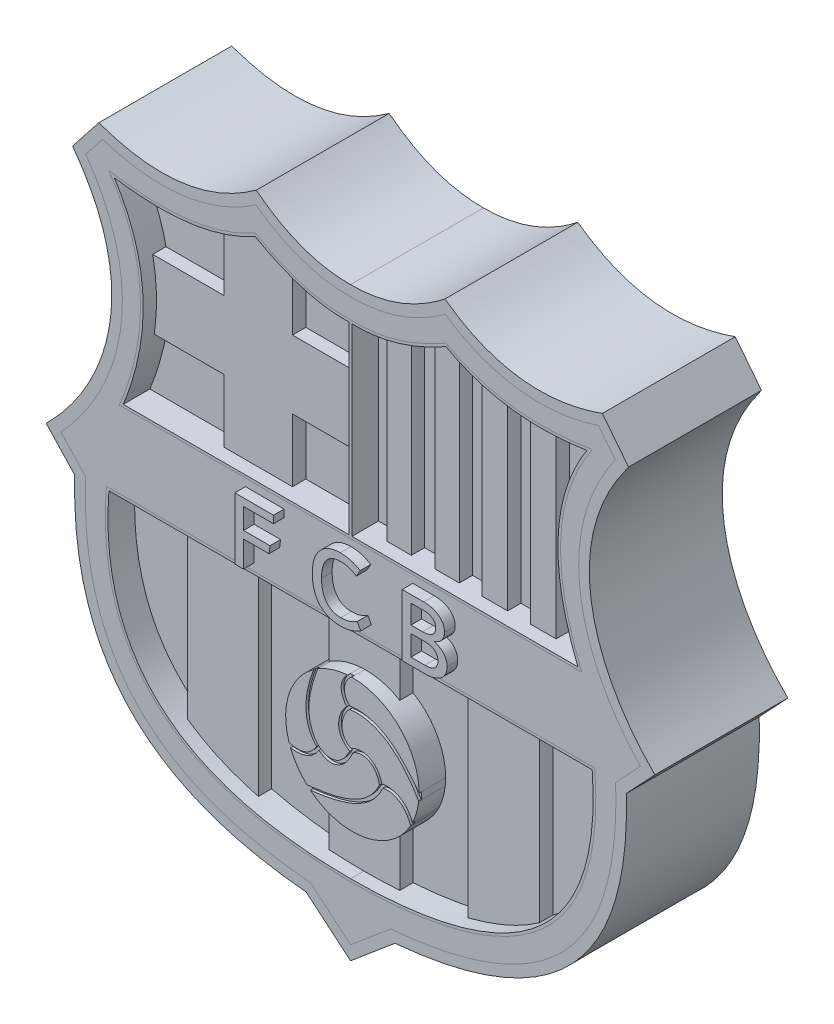
from build123d import *

# Parameters (mm, degrees)
BOSS_EXTRUDE1_DEPTH    = 50
BOSS_EXTRUDE6_DEPTH    = 200
BOSS_EXTRUDE7_DEPTH    = 20
BOSS_EXTRUDE8_DEPTH    = 25
BOSS_EXTRUDE9_DEPTH    = 25
BOSS_EXTRUDE10_DEPTH   = 25
BOSS_EXTRUDE11_DEPTH   = 50
BOSS_EXTRUDE11_2_DEPTH = 50
BOSS_EXTRUDE11_3_DEPTH = 50
BOSS_EXTRUDE11_4_DEPTH = 50
BOSS_EXTRUDE11_5_DEPTH = 50
BOSS_EXTRUDE11_6_DEPTH = 50
BOSS_EXTRUDE12_DEPTH   = 45
BOSS_EXTRUDE13_DEPTH   = 250
BOSS_EXTRUDE14_DEPTH   = 50
BOSS_EXTRUDE15_DEPTH   = 50
SCALE1_SCALE           = 0.025


with BuildPart() as part:
    # Sketch1 → Boss-Extrude1 (new body)
    with BuildSketch(Plane.XY):
        with BuildLine():
            Line((133.46356752, 1126.986385644), (102.003199872, 1087.003819543))
            add(Edge.make_bspline(
                [(102.003199872, 1087.003819543), (226.59890822, 910.602601387), (164.417183447, 726.984348134), (55.005234339, 611.019063396)],
                knots=[0, 0, 0, 0, 1, 1, 1, 1], degree=3))
            Line((55.005234339, 611.019063396), (101.459625842, 561.530346196))
            add(Edge.make_bspline(
                [(101.459625842, 561.530346196), (91.839945119, 295.037245246), (208.985417933, 138.161620848), (524.532272448, 111.554095907)],
                knots=[0, 0, 0, 0, 1, 1, 1, 1], degree=3))
            Line((524.532272448, 111.554095907), (600, 48.025782711))
            Line((600, 48.025782711), (675.467727552, 111.554095907))
            add(Edge.make_bspline(
                [(1098.540374158, 561.530346196), (1108.160054881, 295.037245246), (991.014582067, 138.161620848), (675.467727552, 111.554095907)],
                knots=[0, 0, 0, 0, 1, 1, 1, 1], degree=3))
            Line((1098.540374158, 561.530346196), (1144.994765661, 611.019063396))
            add(Edge.make_bspline(
                [(1097.996800128, 1087.003819543), (973.40109178, 910.602601387), (1035.582816553, 726.984348134), (1144.994765661, 611.019063396)],
                knots=[0, 0, 0, 0, 1, 1, 1, 1], degree=3))
            Line((1097.996800128, 1087.003819543), (1066.53643248, 1126.986385644))
            add(Edge.make_bspline(
                [(1066.53643248, 1126.986385644), (956.376381864, 1090.894186077), (858.242372746, 1109.560348258), (778.016213479, 1164.016239891)],
                knots=[0, 0, 0, 0, 1, 1, 1, 1], degree=3))
            add(Edge.make_bspline(
                [(778.016213479, 1164.016239891), (694.016596835, 1102.729663633), (600, 1103.445934964)],
                knots=[0, 0, 0, 1, 1, 1], degree=2))
            add(Edge.make_bspline(
                [(421.983786521, 1164.016239891), (505.983403165, 1102.729663633), (600, 1103.445934964)],
                knots=[0, 0, 0, 1, 1, 1], degree=2))
            add(Edge.make_bspline(
                [(133.46356752, 1126.986385644), (243.623618136, 1090.894186077), (341.757627254, 1109.560348258), (421.983786521, 1164.016239891)],
                knots=[0, 0, 0, 0, 1, 1, 1, 1], degree=3))
        make_face()
        with BuildLine():
            Line((172.441007034, 714.584022584), (1027.558992966, 714.584022584))
            add(Edge.make_bspline(
                [(1044.51545144, 1075.547155929), (979.007192098, 974.464177507), (971.599630022, 853.448573897), (1027.558992966, 714.584022584)],
                knots=[0, 0, 0, 0, 1, 1, 1, 1], degree=3))
            add(Edge.make_bspline(
                [(779.496937286, 1112.101280667), (857.550676858, 1068.974155239), (945.835947373, 1060.649513102), (1044.51545144, 1075.547155929)],
                knots=[0, 0, 0, 0, 1, 1, 1, 1], degree=3))
            add(Edge.make_bspline(
                [(779.496937286, 1112.101280667), (725.028679692, 1081.546713353), (665.061052799, 1058.223258661), (600, 1061.197954031)],
                knots=[0, 0, 0, 0, 1, 1, 1, 1], degree=3))
            add(Edge.make_bspline(
                [(420.503062714, 1112.101280667), (474.971320308, 1081.546713353), (534.938947201, 1058.223258661), (600, 1061.197954031)],
                knots=[0, 0, 0, 0, 1, 1, 1, 1], degree=3))
            add(Edge.make_bspline(
                [(420.503062714, 1112.101280667), (342.449323142, 1068.974155239), (254.164052627, 1060.649513102), (155.48454856, 1075.547155929)],
                knots=[0, 0, 0, 0, 1, 1, 1, 1], degree=3))
            add(Edge.make_bspline(
                [(155.48454856, 1075.547155929), (220.992807902, 974.464177507), (228.400369978, 853.448573897), (172.441007034, 714.584022584)],
                knots=[0, 0, 0, 0, 1, 1, 1, 1], degree=3))
        make_face(mode=Mode.SUBTRACT)
        with BuildLine():
            Line((145.430413216, 560.4872641), (1054.569586784, 560.4872641))
            add(Edge.make_bspline(
                [(1054.569586784, 560.4872641), (1076.926440053, 261.321472085), (886.665840762, 156.321066377), (600, 155.632939768)],
                knots=[0, 0, 0, 0, 1, 1, 1, 1], degree=3))
            add(Edge.make_bspline(
                [(145.430413216, 560.4872641), (123.073559947, 261.321472085), (313.334159238, 156.321066377), (600, 155.632939768)],
                knots=[0, 0, 0, 0, 1, 1, 1, 1], degree=3))
        make_face(mode=Mode.SUBTRACT)
    extrude(amount=BOSS_EXTRUDE1_DEPTH)

    # Sketch17 → Boss-Extrude6 (add)
    with BuildSketch(Plane(origin=(0, 0, 0), x_dir=(-1, 0, 0), z_dir=(0, 0, -1))):
        with BuildLine():
            Line((-1066.53643248, 1126.986385644), (-1097.996800128, 1087.003819543))
            add(Edge.make_bspline(
                [(-1097.996800128, 1087.003819543), (-973.40109178, 910.602601387), (-1035.582816553, 726.984348134), (-1144.994765661, 611.019063396)],
                knots=[0, 0, 0, 0, 1, 1, 1, 1], degree=3))
            Line((-1144.994765661, 611.019063396), (-1098.540374158, 561.530346196))
            add(Edge.make_bspline(
                [(-1098.540374158, 561.530346196), (-1108.160054881, 295.037245246), (-991.014582067, 138.161620848), (-675.467727552, 111.554095907)],
                knots=[0, 0, 0, 0, 1, 1, 1, 1], degree=3))
            Line((-675.467727552, 111.554095907), (-600, 48.025782711))
            Line((-600, 48.025782711), (-524.532272448, 111.554095907))
            add(Edge.make_bspline(
                [(-524.532272448, 111.554095907), (-208.985417933, 138.161620848), (-91.839945119, 295.037245246), (-101.459625842, 561.530346196)],
                knots=[0, 0, 0, 0, 1, 1, 1, 1], degree=3))
            Line((-101.459625842, 561.530346196), (-55.005234339, 611.019063396))
            add(Edge.make_bspline(
                [(-55.005234339, 611.019063396), (-164.417183447, 726.984348134), (-226.59890822, 910.602601387), (-102.003199872, 1087.003819543)],
                knots=[0, 0, 0, 0, 1, 1, 1, 1], degree=3))
            Line((-102.003199872, 1087.003819543), (-133.46356752, 1126.986385644))
            add(Edge.make_bspline(
                [(-133.46356752, 1126.986385644), (-243.623618136, 1090.894186077), (-341.757627254, 1109.560348258), (-421.983786521, 1164.016239891)],
                knots=[0, 0, 0, 0, 1, 1, 1, 1], degree=3))
            add(Edge.make_bspline(
                [(-421.983786521, 1164.016239891), (-505.983403168, 1102.72966363), (-600.000000008, 1103.445934964)],
                knots=[0, 0, 0, 1, 1, 1], degree=2))
            add(Edge.make_bspline(
                [(-600.000000008, 1103.445934964), (-694.016596803, 1102.729663636), (-778.016213415, 1164.016239844)],
                knots=[0, 0, 0, 1, 1, 1], degree=2))
            add(Edge.make_bspline(
                [(-778.016213415, 1164.016239844), (-858.242372746, 1109.560348258), (-956.376381864, 1090.894186077), (-1066.53643248, 1126.986385644)],
                knots=[0, 0, 0, 0, 1, 1, 1, 1], degree=3))
        make_face()
    extrude(amount=BOSS_EXTRUDE6_DEPTH)

    # Sketch18 → Boss-Extrude7 (add)
    # profile 1 of 3: a face of its own
    with BuildSketch(Plane.XY.offset(50)):
        Polygon((475.105998454, 681.423513201), (418.659569882, 681.423513201), (418.659569882, 642.351191773), (468.477427025, 642.351191773), (466.664927025, 628.394941773), (418.659569882, 628.394941773), (418.659569882, 579.379763201), (402.19171274, 579.379763201), (402.19171274, 695.379763201), (475.105998454, 695.379763201), align=None)
    # profile 2 of 3: a face of its own
    with BuildSketch(Plane.XY.offset(50)):
        with BuildLine():
            add(Edge.make_bspline(
                [(601.09171274, 577.722620344), (599.64078982, 577.736546109), (596.803148816, 577.763781409), (592.637975877, 578.152143343), (588.660733179, 578.710587918), (584.847529131, 579.477291582), (581.235418211, 580.518104432), (577.788756655, 581.764633074), (574.525723668, 583.230393223), (571.459506686, 584.951956666), (568.585197073, 586.8753144), (565.873644104, 588.964972852), (563.397625684, 591.287782315), (561.069793374, 593.754782096), (558.93837799, 596.424908978), (557.039393152, 599.310346491), (555.279005243, 602.348346165), (553.764333604, 605.597871871), (552.425076042, 609.008144549), (551.255584939, 612.569227776), (550.270743801, 616.278316318), (549.481319636, 620.145444362), (548.817097072, 624.150206808), (548.402751596, 628.310786234), (548.090518187, 632.610726673), (548.072368168, 635.532123635), (548.063141311, 637.017263201)],
                knots=[0, 0, 0, 0, 1.152401246, 2.253807549, 3.320597844, 4.342723539, 5.341203386, 6.304395466, 7.252752992, 8.179923201, 9.094762417, 9.998742316, 10.896457915, 11.789156762, 12.69199146, 13.606830677, 14.531410523, 15.479296852, 16.452204652, 17.441077364, 18.455745475, 19.499406348, 20.576069463, 21.679459379, 22.820315508, 24, 24, 24, 24], degree=3))
            add(Edge.make_bspline(
                [(548.063141311, 637.017263201), (548.076728654, 638.727024194), (548.103250193, 642.064357608), (548.493779535, 646.953288135), (549.039172089, 651.606872279), (549.849546238, 656.032934079), (550.869111642, 660.224215315), (552.151749987, 664.171069103), (553.61041163, 667.900212829), (555.360301187, 671.363736199), (557.278519605, 674.597686727), (559.328918781, 677.6222799), (561.528652818, 680.41505828), (563.853244409, 682.988488091), (566.336918935, 685.310103856), (568.960625632, 687.41134927), (571.71890666, 689.311087435), (574.644370873, 690.927542563), (577.639112249, 692.382926177), (580.726947571, 693.63182089), (583.89444379, 694.649142995), (587.108619811, 695.550741349), (590.405739726, 696.221465205), (593.779781809, 696.678643342), (597.219872938, 696.972780497), (599.537552649, 697.015445855), (600.703319882, 697.036906058)],
                knots=[0, 0, 0, 0, 1.362261834, 2.659039452, 3.906420423, 5.095084035, 6.242900915, 7.341449979, 8.400368739, 9.430912882, 10.430126428, 11.395525412, 12.340916007, 13.261249953, 14.156698004, 15.047271391, 15.93826972, 16.82220361, 17.708249395, 18.59089764, 19.47405501, 20.358497285, 21.250212245, 22.152975353, 23.070967052, 24, 24, 24, 24], degree=3))
            add(Edge.make_bspline(
                [(600.703319882, 697.036906058), (602.474163744, 697.013133424), (605.954760536, 696.966408269), (611.056417772, 696.419323172), (615.950495213, 695.611865507), (620.642090118, 694.421280245), (625.194553586, 692.959048044), (629.602464881, 691.109092942), (633.954153774, 689.041666258), (636.724071926, 687.384530705), (638.118498454, 686.550298915)],
                knots=[0, 0, 0, 0, 1.078692588, 2.120172219, 3.123210728, 4.099087256, 5.067122433, 6.034099663, 7.010330475, 8, 8, 8, 8], degree=3))
            Line((638.118498454, 686.550298915), (630.99796274, 674.121727487))
            add(Edge.make_bspline(
                [(630.99796274, 674.121727487), (629.842648414, 674.838043645), (627.558352419, 676.25434923), (623.984019696, 678.063088733), (620.364379066, 679.622189893), (616.68203127, 680.903327804), (612.927074029, 681.85668375), (609.120596735, 682.548928963), (605.246400344, 683.021707986), (602.63805537, 683.060915165), (601.324748454, 683.080656058)],
                knots=[0, 0, 0, 0, 1.037467206, 2.051287802, 3.055013741, 4.044908042, 5.024660619, 6.009563252, 6.997811112, 8, 8, 8, 8], degree=3))
            add(Edge.make_bspline(
                [(601.324748454, 683.080656058), (599.829713602, 683.050033861), (596.93156437, 682.990672238), (592.738652643, 682.414628631), (588.858544831, 681.459310632), (585.269732594, 680.138929242), (581.979284558, 678.417133839), (578.985902519, 676.317867907), (576.312767096, 673.817501905), (573.951987783, 670.958941055), (571.924451582, 667.751502741), (570.13416109, 664.293975719), (568.588519342, 660.577943243), (567.390534831, 656.562769786), (566.436762604, 652.287508454), (565.738543241, 647.738528147), (565.320668417, 642.92012358), (565.277904328, 639.616031885), (565.255998454, 637.923513201)],
                knots=[0, 0, 0, 0, 1.090208122, 2.11338607, 3.080077519, 4.00054902, 4.896176672, 5.781877576, 6.65955173, 7.558471289, 8.47894279, 9.422387076, 10.396433003, 11.410268442, 12.475013277, 13.589961148, 14.765459267, 16, 16, 16, 16], degree=3))
            add(Edge.make_bspline(
                [(565.255998454, 637.923513201), (565.289176182, 636.170706256), (565.353828854, 632.755051838), (565.758489543, 627.770708952), (566.478876945, 623.080707545), (567.493520572, 618.676270994), (568.766446164, 614.549723451), (570.383890681, 610.735965405), (572.257012772, 607.199141514), (574.41429067, 603.961804269), (576.890707228, 601.076140689), (579.60842609, 598.537570208), (582.632720293, 596.422550156), (585.915044132, 594.673023427), (589.485505558, 593.326760648), (593.319779576, 592.385266812), (597.411720546, 591.759521327), (600.234805196, 591.706268359), (601.687248454, 591.678870344)],
                knots=[0, 0, 0, 0, 1.259694321, 2.454737236, 3.590776693, 4.66657999, 5.700420284, 6.689995947, 7.639006296, 8.573143387, 9.479372, 10.366030153, 11.238516259, 12.123676147, 13.032596606, 13.97282991, 14.957045255, 16, 16, 16, 16], degree=3))
            add(Edge.make_bspline(
                [(601.687248454, 591.678870344), (603.164293937, 591.709285485), (606.056049399, 591.768832161), (610.271085949, 592.215865892), (614.267474563, 592.928673685), (618.064561602, 593.983307081), (621.740119411, 595.337973356), (625.397041019, 596.881507329), (629.041548716, 598.707232972), (631.419420931, 600.089764479), (632.62921274, 600.793156058)],
                knots=[0, 0, 0, 0, 1.084007551, 2.122266913, 3.107669922, 4.060605003, 5.010523825, 5.981318343, 6.972953837, 8, 8, 8, 8], degree=3))
            Line((632.62921274, 600.793156058), (639.205998454, 588.90833463))
            add(Edge.make_bspline(
                [(639.205998454, 588.90833463), (637.662621064, 588.026003784), (634.627508856, 586.290865547), (629.984294545, 584.064556992), (625.430578209, 582.091924023), (620.872492353, 580.495874552), (616.225247492, 579.216542934), (611.380426549, 578.354669664), (606.307900099, 577.827550779), (602.853740771, 577.758065844), (601.09171274, 577.722620344)],
                knots=[0, 0, 0, 0, 1.059879771, 2.084295166, 3.069031927, 4.018092589, 4.962058864, 5.940371365, 6.949346847, 8, 8, 8, 8], degree=3))
        make_face()
    # profile 3 of 3: a face of its own
    with BuildSketch(Plane.XY.offset(50)):
        with BuildLine():
            add(Edge.make_bspline(
                [(776.895284168, 640.56458463), (777.918533608, 640.304597264), (779.926450071, 639.79442556), (782.783003775, 638.774191737), (785.446257187, 637.639697929), (787.893579979, 636.346224248), (790.122401017, 634.879347525), (792.19383037, 633.317885528), (794.00255705, 631.53913759), (795.608646006, 629.639584705), (797.040196134, 627.653631762), (798.243852035, 625.56459402), (799.328567112, 623.444706681), (800.178837284, 621.238941788), (800.824955027, 618.974782945), (801.293310134, 616.654856432), (801.584473535, 614.273427393), (801.627285645, 612.661527052), (801.648855597, 611.849406058)],
                knots=[0, 0, 0, 0, 1.229068441, 2.411793899, 3.528508263, 4.598830236, 5.630498207, 6.633860536, 7.614917479, 8.577726652, 9.528973143, 10.461713734, 11.383336897, 12.299957327, 13.2099387, 14.122747572, 15.054187117, 16, 16, 16, 16], degree=3))
            add(Edge.make_bspline(
                [(801.648855597, 611.849406058), (801.586493769, 610.334981127), (801.463890706, 607.357628769), (800.573661413, 603.012270057), (799.044708957, 598.927359451), (796.94983634, 595.095765085), (794.219526969, 591.605359121), (790.92650798, 588.451661133), (786.980680622, 585.764076205), (782.488525391, 583.459576701), (777.42880144, 581.617844176), (771.83839686, 580.327943483), (765.742532915, 579.505452392), (761.509117662, 579.422681195), (759.314034168, 579.379763201)],
                knots=[0, 0, 0, 0, 0.908229122, 1.785574223, 2.647318915, 3.516343686, 4.39460501, 5.295528646, 6.240601218, 7.247931, 8.31756617, 9.461667013, 10.683839759, 12, 12, 12, 12], degree=3))
            Line((759.314034168, 579.379763201), (717.134569882, 579.379763201))
            Line((717.134569882, 579.379763201), (717.134569882, 695.379763201))
            Line((717.134569882, 695.379763201), (757.630998454, 695.379763201))
            add(Edge.make_bspline(
                [(757.630998454, 695.379763201), (759.592630829, 695.340379894), (763.383611786, 695.264269116), (768.858979732, 694.52939441), (773.913251922, 693.322341778), (778.533377988, 691.640697423), (782.691777975, 689.560934127), (786.327325724, 687.072096231), (789.493529248, 684.266326544), (792.08020711, 681.059091741), (794.162749881, 677.572190633), (795.61135578, 673.787449881), (796.531341748, 669.755338476), (796.628065251, 666.971760245), (796.677427025, 665.551191773)],
                knots=[0, 0, 0, 0, 1.281114256, 2.475835845, 3.601497442, 4.6701157, 5.681428971, 6.630867444, 7.541286769, 8.435227113, 9.312433322, 10.183728554, 11.073085884, 12, 12, 12, 12], degree=3))
            add(Edge.make_bspline(
                [(796.677427025, 665.551191773), (796.63006177, 664.181792687), (796.536924302, 661.489051743), (795.578868078, 657.587726458), (794.099964996, 653.896979036), (792.336286173, 651.060606446), (790.663361655, 648.919593765), (789.20248847, 647.413149235), (787.564925652, 646.020616935), (785.769714029, 644.712337159), (783.789094198, 643.536867905), (781.669518607, 642.40470422), (779.345745245, 641.430991799), (777.726774324, 640.858573806), (776.895284168, 640.56458463)],
                knots=[0, 0, 0, 0, 1.43366631, 2.819113884, 4.187392771, 5.589272928, 6.304604261, 7.03439392, 7.785485683, 8.556813947, 9.360959316, 10.199081699, 11.075063166, 12, 12, 12, 12], degree=3))
        make_face()
        with BuildLine():
            Line((733.602427025, 681.423513201), (733.602427025, 645.665477487))
            Line((733.602427025, 645.665477487), (755.455998454, 645.665477487))
            add(Edge.make_bspline(
                [(755.455998454, 645.665477487), (757.211258951, 645.717916701), (760.570504189, 645.818275697), (765.353873214, 646.634655882), (769.611258669, 648.044633771), (772.778903264, 649.659019205), (774.972194352, 651.266010104), (776.389113624, 652.642784266), (777.550589077, 654.226040623), (778.550266346, 655.933950004), (779.305515744, 657.819230059), (779.806490827, 659.869166323), (780.165252243, 662.07771606), (780.194463866, 663.616279004), (780.209569882, 664.411906058)],
                knots=[0, 0, 0, 0, 1.79175693, 3.429092685, 4.934105334, 6.357253839, 7.037662009, 7.704521192, 8.365530619, 9.036743662, 9.72085205, 10.430540755, 11.188395743, 12, 12, 12, 12], degree=3))
            add(Edge.make_bspline(
                [(780.209569882, 664.411906058), (780.17972809, 665.208007933), (780.120812727, 666.779717538), (779.653349451, 669.072811959), (778.833569193, 671.223512528), (777.717373377, 673.221281135), (776.301203191, 675.068218033), (774.55690728, 676.696458197), (772.501751533, 678.10730922), (770.159107633, 679.294930359), (767.534001378, 680.248978182), (764.64342289, 680.944619771), (761.492602073, 681.361631009), (759.306725156, 681.402400395), (758.174748454, 681.423513201)],
                knots=[0, 0, 0, 0, 0.914983896, 1.806413252, 2.676426615, 3.551688379, 4.429085617, 5.341806165, 6.283316826, 7.286417286, 8.353924127, 9.487653094, 10.698957777, 12, 12, 12, 12], degree=3))
            Line((758.174748454, 681.423513201), (733.602427025, 681.423513201))
        make_face(mode=Mode.SUBTRACT)
        with BuildLine():
            add(Edge.make_bspline(
                [(759.75421274, 593.336013201), (760.807793253, 593.347380997), (762.840748815, 593.369315936), (765.772364228, 593.635790313), (768.479566101, 594.047684151), (770.965162315, 594.595229331), (773.215545539, 595.357718525), (775.245039724, 596.265372428), (777.078969765, 597.306580288), (778.639398089, 598.58441304), (780.011628045, 599.945887808), (781.189994799, 601.421505581), (782.207304119, 602.976206328), (783.042318061, 604.632600409), (783.656203925, 606.39601109), (784.136078735, 608.228385359), (784.38526558, 610.168299145), (784.432070564, 611.48631656), (784.455998454, 612.160120344)],
                knots=[0, 0, 0, 0, 1.435199343, 2.769315158, 4.00678371, 5.165046219, 6.232393296, 7.237819299, 8.191860384, 9.095498011, 9.976977071, 10.821843515, 11.66342955, 12.50493341, 13.341905271, 14.203307508, 15.08148543, 16, 16, 16, 16], degree=3))
            add(Edge.make_bspline(
                [(784.455998454, 612.160120344), (784.434617669, 612.894571414), (784.39294691, 614.326003091), (784.112193381, 616.411506925), (783.611817525, 618.369916065), (782.935847333, 620.217894403), (782.087757936, 621.966784294), (781.007397717, 623.586336146), (779.737880693, 625.088135875), (778.275684646, 626.464281658), (776.647863621, 627.716637406), (774.807478844, 628.783532092), (772.781617856, 629.682102341), (770.574758205, 630.439037231), (768.178304836, 630.997085205), (765.600103795, 631.408030556), (762.832416368, 631.674909411), (760.920030661, 631.697564036), (759.93546274, 631.709227487)],
                knots=[0, 0, 0, 0, 0.991708695, 1.932822074, 2.834503666, 3.715692415, 4.586102876, 5.452368317, 6.337248569, 7.235836904, 8.15888109, 9.104314168, 10.100668534, 11.147348607, 12.249770514, 13.418513648, 14.670953961, 16, 16, 16, 16], degree=3))
            Line((759.93546274, 631.709227487), (733.602427025, 631.709227487))
            Line((733.602427025, 631.709227487), (733.602427025, 593.336013201))
            Line((733.602427025, 593.336013201), (759.75421274, 593.336013201))
        make_face(mode=Mode.SUBTRACT)
    extrude(amount=BOSS_EXTRUDE7_DEPTH)

    # Sketch20 → Boss-Extrude8 (add)
    with BuildSketch(Plane.XY):
        with BuildLine():
            Line((598.066093468, 961.645965498), (598.066093468, 833.080043233))
            Line((598.066093468, 833.080043233), (465.797978764, 833.080043233))
            Line((465.797978764, 833.080043233), (465.797978764, 714.584022584))
            Line((465.797978764, 714.584022584), (336.953418896, 714.584022584))
            Line((336.953418896, 714.584022584), (336.953418896, 833.080043233))
            Line((336.953418896, 833.080043233), (205.603276252, 833.080043233))
            add(Edge.make_bspline(
                [(202.801295823, 961.645965498), (211.267976093, 921.147951999), (212.278954581, 878.262184077), (205.603276252, 833.080043233)],
                knots=[0.351533435, 0.351533435, 0.351533435, 0.351533435, 0.704182388, 0.704182388, 0.704182388, 0.704182388], degree=3))
            Line((202.801295823, 961.645965498), (336.953418896, 961.645965498))
            Line((336.953418896, 961.645965498), (336.953418896, 1079.633198014))
            add(Edge.make_bspline(
                [(420.503062714, 1112.101280667), (393.848495135, 1097.373800785), (366.00077363, 1086.704825911), (336.953418896, 1079.633198014)],
                knots=[0, 0, 0, 0, 0.341489949, 0.341489949, 0.341489949, 0.341489949], degree=3))
            add(Edge.make_bspline(
                [(465.797978764, 1089.317224126), (450.304418802, 1096.135304794), (435.203453337, 1103.854935095), (420.503062714, 1112.101280667)],
                knots=[0.730110871, 0.730110871, 0.730110871, 0.730110871, 1, 1, 1, 1], degree=3))
            Line((465.797978764, 1089.317224126), (465.797978764, 961.645965498))
            Line((465.797978764, 961.645965498), (598.066093468, 961.645965498))
        make_face()
    extrude(amount=BOSS_EXTRUDE8_DEPTH)

    # Sketch21 → Boss-Extrude9 (add)
    with BuildSketch(Plane.XY):
        with BuildLine():
            Line((643.219410565, 1062.977132612), (643.219410565, 714.584022584))
            Line((643.219410565, 714.584022584), (689.367418135, 714.584022584))
            Line((689.367418135, 714.584022584), (689.367418135, 1072.759310695))
            add(Edge.make_bspline(
                [(689.367418135, 1072.759310695), (674.314041424, 1068.318934527), (658.929248289, 1064.958447466), (643.219410565, 1062.977132612)],
                knots=[0.524187621, 0.524187621, 0.524187621, 0.524187621, 0.774567634, 0.774567634, 0.774567634, 0.774567634], degree=3))
        make_face()
        with BuildLine():
            Line((733.91816673, 1089.192431639), (733.91816673, 714.584022584))
            Line((733.91816673, 714.584022584), (779.496937286, 714.584022584))
            Line((779.496937286, 714.584022584), (779.496937286, 1112.101280667))
            add(Edge.make_bspline(
                [(779.496937286, 1112.101280667), (764.706786215, 1103.804582986), (749.511153556, 1096.041052451), (733.91816673, 1089.192431639)],
                knots=[0, 0, 0, 0, 0.27153707, 0.27153707, 0.27153707, 0.27153707], degree=3))
        make_face()
        with BuildLine():
            Line((822.539317923, 1092.16660201), (822.539317923, 714.584022584))
            Line((822.539317923, 714.584022584), (870.471104951, 714.584022584))
            Line((870.471104951, 714.584022584), (870.471104951, 1077.909513203))
            add(Edge.make_bspline(
                [(870.471104951, 1077.909513203), (854.119158892, 1081.523075558), (838.142273851, 1086.248584429), (822.539317923, 1092.16660201)],
                knots=[0.629516707, 0.629516707, 0.629516707, 0.629516707, 0.82041634, 0.82041634, 0.82041634, 0.82041634], degree=3))
        make_face()
        with BuildLine():
            Line((913.606758407, 1070.990600452), (913.606758407, 714.584022584))
            Line((913.606758407, 714.584022584), (961.632360453, 714.584022584))
            Line((961.632360453, 714.584022584), (961.632360453, 1068.729460259))
            add(Edge.make_bspline(
                [(961.632360453, 1068.729460259), (945.302983706, 1068.637561432), (929.294746226, 1069.370169255), (913.606758407, 1070.990600452)],
                knots=[0.288742663, 0.288742663, 0.288742663, 0.288742663, 0.464913551, 0.464913551, 0.464913551, 0.464913551], degree=3))
        make_face()
    extrude(amount=BOSS_EXTRUDE9_DEPTH)

    # Sketch22 → Boss-Extrude10 (add)
    with BuildSketch(Plane.XY):
        with BuildLine():
            Line((268.360003742, 560.4872641), (268.360003742, 237.456228291))
            add(Edge.make_bspline(
                [(268.360003742, 237.456228291), (305.727979892, 210.697807573), (350.574996126, 191.188941713), (401.630165147, 177.947004433)],
                knots=[0.52331925, 0.52331925, 0.52331925, 0.52331925, 0.745284552, 0.745284552, 0.745284552, 0.745284552], degree=3))
            Line((401.630165147, 177.947004433), (401.630165147, 560.4872641))
            Line((401.630165147, 560.4872641), (268.360003742, 560.4872641))
        make_face()
        with BuildLine():
            Line((534.224637807, 560.4872641), (534.224637807, 157.773625286))
            add(Edge.make_bspline(
                [(534.224637807, 157.773625286), (555.516085268, 156.386048225), (577.460036518, 155.687045791), (600, 155.632939768)],
                knots=[0.921371994, 0.921371994, 0.921371994, 0.921371994, 1, 1, 1, 1], degree=3))
            add(Edge.make_bspline(
                [(600, 155.632939768), (623.187956662, 155.688601266), (645.745139423, 156.426771953), (667.610043148, 157.89500645)],
                knots=[0, 0, 0, 0, 0.080888454, 0.080888454, 0.080888454, 0.080888454], degree=3))
            Line((667.610043148, 157.89500645), (667.610043148, 560.4872641))
            Line((667.610043148, 560.4872641), (534.224637807, 560.4872641))
        make_face()
        with BuildLine():
            Line((796.346472728, 560.4872641), (796.346472728, 177.426322341))
            add(Edge.make_bspline(
                [(796.346472728, 177.426322341), (847.666070688, 190.528877775), (892.769862495, 209.91006385), (930.379435964, 236.558324945)],
                knots=[0.251787911, 0.251787911, 0.251787911, 0.251787911, 0.474190435, 0.474190435, 0.474190435, 0.474190435], degree=3))
            Line((930.379435964, 236.558324945), (930.379435964, 560.4872641))
            Line((930.379435964, 560.4872641), (796.346472728, 560.4872641))
        make_face()
    extrude(amount=BOSS_EXTRUDE10_DEPTH)



with BuildPart() as body_2:
    # Sketch23 → Boss-Extrude11 (new body)
    with BuildSketch(Plane.XY):
        with BuildLine():
            add(Edge.make_bspline(
                [(598.456957748, 436.303843272), (647.83003756, 443.908862508), (688.04962313, 415.376093756), (728.928267165, 359.520034831)],
                knots=[0, 0, 0, 0, 1, 1, 1, 1], degree=3))
            ThreePointArc((728.928267165, 359.520034831), (691.696042155, 448.733542207), (602.090818587, 485.01290806))
            add(Edge.make_bspline(
                [(598.456957748, 436.303843272), (581.368648722, 452.528895663), (588.382979615, 475.046295089), (602.090818587, 485.01290806)],
                knots=[0, 0, 0, 0, 1, 1, 1, 1], degree=3))
        make_face()
    extrude(amount=BOSS_EXTRUDE11_DEPTH)


with BuildPart() as body_3:
    # Sketch23 → Boss-Extrude11 2 (new body)
    with BuildSketch(Plane.XY):
        with BuildLine():
            ThreePointArc((716.530326322, 305.130934688), (724.087023764, 324.998817353), (728.182314384, 345.857029946))
            add(Edge.make_bspline(
                [(598.456957748, 430.54532251), (658.438095866, 439.133484552), (702.96534683, 389.661146495), (728.182314384, 345.857029946)],
                knots=[0, 0, 0, 0, 1, 1, 1, 1], degree=3))
            add(Edge.make_bspline(
                [(598.456957748, 430.54532251), (582.839291882, 416.811434255), (574.617418357, 382.005453921), (600.819217445, 368.197906425)],
                knots=[0, 0, 0, 0, 1, 1, 1, 1], degree=3))
            add(Edge.make_bspline(
                [(600.819217445, 368.197906425), (619.357877893, 379.490668711), (649.352298851, 374.717286695), (659.212175073, 339.36843885)],
                knots=[0, 0, 0, 0, 1, 1, 1, 1], degree=3))
            add(Edge.make_bspline(
                [(659.212175073, 339.36843885), (679.426208885, 344.139872564), (705.871093534, 334.381882075), (716.530326322, 305.130934688)],
                knots=[0, 0, 0, 0, 1, 1, 1, 1], degree=3))
        make_face()
    extrude(amount=BOSS_EXTRUDE11_2_DEPTH)


with BuildPart() as body_4:
    # Sketch23 → Boss-Extrude11 3 (new body)
    with BuildSketch(Plane.XY):
        with BuildLine():
            add(Edge.make_bspline(
                [(594.566156356, 484.706747353), (581.148500616, 472.340833714), (576.252744652, 453.534976704), (592.846823793, 432.146447388)],
                knots=[0, 0, 0, 0, 1, 1, 1, 1], degree=3))
            ThreePointArc((594.566156356, 484.706747353), (565.21756045, 479.061625469), (538.035919935, 466.63721797))
            add(Edge.make_bspline(
                [(538.035919935, 466.63721797), (524.242129912, 427.785400958), (509.947297092, 383.124839708), (536.321439128, 345.762225597)],
                knots=[0, 0, 0, 0, 1, 1, 1, 1], degree=3))
            add(Edge.make_bspline(
                [(536.321439128, 345.762225597), (555.050256263, 326.779535592), (581.00469794, 326.622127581), (598.456957748, 362.614052059)],
                knots=[0, 0, 0, 0, 1, 1, 1, 1], degree=3))
            add(Edge.make_bspline(
                [(592.846823793, 432.146447388), (575.465214491, 415.898421301), (567.710543302, 380.095475206), (598.456957748, 362.614052059)],
                knots=[0, 0, 0, 0, 1, 1, 1, 1], degree=3))
        make_face()
    extrude(amount=BOSS_EXTRUDE11_3_DEPTH)


with BuildPart() as body_5:
    # Sketch23 → Boss-Extrude11 4 (new body)
    with BuildSketch(Plane.XY):
        with BuildLine():
            ThreePointArc((524.441475003, 261.993952864), (627.10721588, 236.274112433), (712.932207684, 298.208233269))
            add(Edge.make_bspline(
                [(660.678413358, 333.396836028), (679.957304651, 338.404899706), (702.930974366, 327.161595068), (712.932207684, 298.208233269)],
                knots=[0, 0, 0, 0, 1, 1, 1, 1], degree=3))
            add(Edge.make_bspline(
                [(660.678413358, 333.396836028), (639.874079688, 286.491933606), (591.501223689, 269.957047756), (524.441475003, 261.993952864)],
                knots=[0, 0, 0, 0, 1, 1, 1, 1], degree=3))
        make_face()
    extrude(amount=BOSS_EXTRUDE11_4_DEPTH)


with BuildPart() as body_6:
    # Sketch23 → Boss-Extrude11 5 (new body)
    with BuildSketch(Plane.XY):
        with BuildLine():
            add(Edge.make_bspline(
                [(530.875985724, 461.923240141), (516.173531585, 426.20741954), (504.438949402, 370.359880976), (536.321439128, 339.36843885)],
                knots=[0, 0, 0, 0, 1, 1, 1, 1], degree=3))
            ThreePointArc((530.875985724, 461.923240141), (484.123316454, 398.463310704), (484.432671196, 319.641492483))
            add(Edge.make_bspline(
                [(536.321439128, 339.36843885), (526.369978, 322.541947184), (510.237569162, 312.13078849), (484.432671196, 319.641492483)],
                knots=[0, 0, 0, 0, 1, 1, 1, 1], degree=3))
        make_face()
    extrude(amount=BOSS_EXTRUDE11_5_DEPTH)


with BuildPart() as body_7:
    # Sketch23 → Boss-Extrude11 6 (new body)
    with BuildSketch(Plane.XY):
        with BuildLine():
            ThreePointArc((487.116973744, 312.382650278), (500.038388004, 288.380855142), (517.837423783, 267.735191152))
            add(Edge.make_bspline(
                [(654.419524669, 335.3955936), (633.345074526, 290.389479064), (587.578626476, 274.743902582), (517.837423783, 267.735191152)],
                knots=[0, 0, 0, 0, 1, 1, 1, 1], degree=3))
            add(Edge.make_bspline(
                [(604.266326027, 362.614052059), (619.360475847, 374.188389504), (646.729465763, 369.462349577), (654.419524669, 335.3955936)],
                knots=[0, 0, 0, 0, 1, 1, 1, 1], degree=3))
            add(Edge.make_bspline(
                [(540.803665732, 335.3955936), (566.445130371, 314.589976681), (591.204257189, 331.946586092), (604.266326027, 362.614052059)],
                knots=[0, 0, 0, 0, 1, 1, 1, 1], degree=3))
            add(Edge.make_bspline(
                [(540.803665732, 335.3955936), (529.967144634, 317.921703329), (512.836206528, 308.740988998), (487.116973744, 312.382650278)],
                knots=[0, 0, 0, 0, 1, 1, 1, 1], degree=3))
        make_face()
    extrude(amount=BOSS_EXTRUDE11_6_DEPTH)


with BuildPart() as part_1:
    add(part.part)

    add(body_2.part)  # Boss-Extrude12 merges body 2

    add(body_3.part)  # Boss-Extrude12 merges body 3

    add(body_4.part)  # Boss-Extrude12 merges body 4

    add(body_5.part)  # Boss-Extrude12 merges body 5

    add(body_6.part)  # Boss-Extrude12 merges body 6

    add(body_7.part)  # Boss-Extrude12 merges body 7
    # Sketch24 → Boss-Extrude12 (add)
    with BuildSketch(Plane.XY):
        with BuildLine():
            Line((484.432671196, 319.641492483), (487.116973744, 312.382650278))
            add(Edge.make_bspline(
                [(487.116973744, 312.382650278), (512.836206528, 308.740988998), (529.967144634, 317.921703329), (540.803665732, 335.3955936)],
                knots=[0.182579713, 0.182579713, 0.182579713, 0.182579713, 1.182579713, 1.182579713, 1.182579713, 1.182579713], degree=3))
            add(Edge.make_bspline(
                [(604.266326027, 362.614052059), (591.204257189, 331.946586092), (566.445130371, 314.589976681), (540.803665732, 335.3955936)],
                knots=[0, 0, 0, 0, 1, 1, 1, 1], degree=3))
            add(Edge.make_bspline(
                [(654.419524669, 335.3955936), (646.729465763, 369.462349577), (619.360475847, 374.188389504), (604.266326027, 362.614052059)],
                knots=[0, 0, 0, 0, 1, 1, 1, 1], degree=3))
            add(Edge.make_bspline(
                [(654.419524669, 335.3955936), (633.345074526, 290.389479064), (587.578626476, 274.743902582), (517.837423783, 267.735191152)],
                knots=[0.080556546, 0.080556546, 0.080556546, 0.080556546, 1.080556546, 1.080556546, 1.080556546, 1.080556546], degree=3))
            Line((517.837423783, 267.735191152), (524.441475003, 261.993952864))
            add(Edge.make_bspline(
                [(524.441475003, 261.993952864), (591.501223689, 269.957047756), (639.874079688, 286.491933606), (660.678413358, 333.396836028)],
                knots=[0.95068801, 0.95068801, 0.95068801, 0.95068801, 1.95068801, 1.95068801, 1.95068801, 1.95068801], degree=3))
            add(Edge.make_bspline(
                [(712.932207684, 298.208233269), (702.930974366, 327.161595068), (679.957304651, 338.404899706), (660.678413358, 333.396836028)],
                knots=[0, 0, 0, 0, 1, 1, 1, 1], degree=3))
            Line((712.932207684, 298.208233269), (716.530326322, 305.130934688))
            add(Edge.make_bspline(
                [(659.212175073, 339.36843885), (679.426208885, 344.139872564), (705.871093534, 334.381882075), (716.530326322, 305.130934688)],
                knots=[0, 0, 0, 0, 1, 1, 1, 1], degree=3))
            add(Edge.make_bspline(
                [(600.819217445, 368.197906425), (619.357877893, 379.490668711), (649.352298851, 374.717286695), (659.212175073, 339.36843885)],
                knots=[0, 0, 0, 0, 1, 1, 1, 1], degree=3))
            add(Edge.make_bspline(
                [(598.456957748, 430.54532251), (582.839291882, 416.811434255), (574.617418357, 382.005453921), (600.819217445, 368.197906425)],
                knots=[0, 0, 0, 0, 1, 1, 1, 1], degree=3))
            add(Edge.make_bspline(
                [(728.182314384, 345.857029946), (702.96534683, 389.661146495), (658.438095866, 439.133484552), (598.456957748, 430.54532251)],
                knots=[0, 0, 0, 0, 1, 1, 1, 1], degree=3))
            Line((728.182314384, 345.857029946), (728.928267165, 359.520034831))
            add(Edge.make_bspline(
                [(598.456957748, 436.303843272), (647.83003756, 443.908862508), (688.04962313, 415.376093756), (728.928267165, 359.520034831)],
                knots=[0, 0, 0, 0, 1, 1, 1, 1], degree=3))
            add(Edge.make_bspline(
                [(602.090818587, 485.01290806), (588.382979615, 475.046295089), (581.368648722, 452.528895663), (598.456957748, 436.303843272)],
                knots=[0, 0, 0, 0, 1, 1, 1, 1], degree=3))
            Line((602.090818587, 485.01290806), (594.566156356, 484.706747353))
            add(Edge.make_bspline(
                [(592.846823793, 432.146447388), (576.252744652, 453.534976704), (581.148500616, 472.340833714), (594.566156356, 484.706747353)],
                knots=[0, 0, 0, 0, 1, 1, 1, 1], degree=3))
            add(Edge.make_bspline(
                [(598.456957748, 362.614052059), (567.710543302, 380.095475206), (575.465214491, 415.898421301), (592.846823793, 432.146447388)],
                knots=[0, 0, 0, 0, 1, 1, 1, 1], degree=3))
            add(Edge.make_bspline(
                [(536.321439128, 345.762225597), (555.050256263, 326.779535592), (581.00469794, 326.622127581), (598.456957748, 362.614052059)],
                knots=[0, 0, 0, 0, 1, 1, 1, 1], degree=3))
            add(Edge.make_bspline(
                [(536.321439128, 345.762225597), (509.947297092, 383.124839708), (524.242129912, 427.785400958), (538.035919935, 466.63721797)],
                knots=[0.972329674, 0.972329674, 0.972329674, 0.972329674, 1.972329674, 1.972329674, 1.972329674, 1.972329674], degree=3))
            Line((538.035919935, 466.63721797), (530.875985724, 461.923240141))
            add(Edge.make_bspline(
                [(530.875985724, 461.923240141), (516.173531585, 426.20741954), (504.438949402, 370.359880976), (536.321439128, 339.36843885)],
                knots=[0.022617071, 0.022617071, 0.022617071, 0.022617071, 1.022617071, 1.022617071, 1.022617071, 1.022617071], degree=3))
            add(Edge.make_bspline(
                [(536.321439128, 339.36843885), (526.369978, 322.541947184), (510.237569162, 312.13078849), (484.432671196, 319.641492483)],
                knots=[0.93262126, 0.93262126, 0.93262126, 0.93262126, 1.93262126, 1.93262126, 1.93262126, 1.93262126], degree=3))
        make_face()
    extrude(amount=BOSS_EXTRUDE12_DEPTH)

    # Sketch25 → Boss-Extrude13 (add)
    with BuildSketch(Plane(origin=(0, 0, -200), x_dir=(-1, 0, 0), z_dir=(0, 0, -1))):
        with BuildLine():
            Line((-1073.603456749, 1150.347868805), (-1122.938261135, 1087.648916919))
            add(Edge.make_bspline(
                [(-1122.938261135, 1087.648916919), (-1121.90414238, 1086.184823087), (-1119.837212757, 1083.258428466), (-1117.247011297, 1079.591469975), (-1115.445886477, 1077.041072612), (-1114.398034919, 1075.558151832), (-1113.420155263, 1074.171158837), (-1112.1968866, 1072.417495841), (-1109.309251595, 1068.225277238), (-1105.114288973, 1061.930840894), (-1099.819516175, 1053.545687388), (-1094.815469022, 1045.164701254), (-1088.526060552, 1033.999599856), (-1081.369810888, 1020.064329785), (-1073.874931967, 1003.388013084), (-1065.290905009, 981.228678256), (-1057.114973825, 953.696971387), (-1051.122066993, 920.999913524), (-1048.698157994, 888.714284736), (-1049.611454399, 856.9169733), (-1054.986081771, 815.292486665), (-1066.171592211, 775.030569403), (-1082.309265462, 736.63242767), (-1096.665129836, 708.907638449), (-1110.314938623, 686.817555018), (-1122.128408037, 669.827366524), (-1131.406077324, 657.443022702), (-1141.067344184, 645.43918297), (-1149.423614015, 635.756110783), (-1155.397689844, 629.177866723), (-1158.224680449, 626.142746639), (-1159.511546069, 624.776154578), (-1160.429918843, 623.80320256), (-1162.012676634, 622.125377164), (-1164.286492619, 619.715517476), (-1167.917449605, 615.867021281), (-1170.642275777, 612.979011292), (-1172.458469129, 611.054035264)],
                knots=[-0.023022389, -0.023022389, -0.023022389, -0.023022389, -0.014722595, -0.006422801, -0.002272904, -0.000197955, 0.001876994, 0.006026891, 0.010176788, 0.026776377, 0.043375965, 0.059975554, 0.076575143, 0.10977432, 0.142973497, 0.176172675, 0.242571029, 0.308969384, 0.375367739, 0.441766094, 0.508164448, 0.640961158, 0.707359513, 0.773757867, 0.840156222, 0.873355399, 0.906554577, 0.939753754, 0.972952931, 0.98955252, 0.997852314, 0.999927263, 1.002002212, 1.006152109, 1.014451903, 1.022751697, 1.039351286, 1.039351286, 1.039351286, 1.039351286], degree=3))
            Line((-1172.458469129, 611.054035264), (-1118.789669621, 553.8796766))
            add(Edge.make_bspline(
                [(-1118.789669621, 553.8796766), (-1118.844599056, 551.808196539), (-1118.939659741, 547.655801807), (-1119.067371902, 539.422024022), (-1119.110693007, 529.212946978), (-1118.974109813, 517.110996249), (-1118.537947708, 501.168378627), (-1117.511064045, 481.605753469), (-1115.490796073, 458.717223436), (-1112.664589725, 436.418594761), (-1107.79716375, 407.479019125), (-1099.604990726, 372.801592409), (-1086.250032423, 333.642828844), (-1069.227145866, 297.027296923), (-1048.41709485, 263.072952676), (-1023.739666232, 231.914319364), (-995.157834152, 203.679099731), (-962.665520916, 178.464154423), (-926.264062728, 156.32333595), (-885.939807821, 137.271591123), (-849.033706625, 123.9611957), (-817.493140012, 114.842957448), (-792.819016371, 108.766952282), (-767.114500616, 103.451540871), (-744.825222706, 99.654498663), (-726.46519243, 96.995703012), (-712.430878266, 95.191089047), (-700.508088964, 93.844559579), (-690.845635006, 92.862900603), (-685.950463776, 92.401898164), (-683.509647537, 92.180917271)],
                knots=[0.010276154, 0.010276154, 0.010276154, 0.010276154, 0.01795667, 0.025637187, 0.040998219, 0.056359252, 0.071720285, 0.10244235, 0.133164416, 0.163886482, 0.194608547, 0.256052678, 0.31749681, 0.378940941, 0.440385072, 0.501829203, 0.563273334, 0.624717465, 0.686161596, 0.747605728, 0.809049859, 0.839771924, 0.87049399, 0.901216055, 0.931938121, 0.947299154, 0.962660187, 0.978021219, 0.985701736, 0.993382252, 0.993382252, 0.993382252, 0.993382252], degree=3))
            Line((-683.509647537, 92.180917271), (-600, 21.882960572))
            Line((-600, 21.882960572), (-516.490352463, 92.180917271))
            add(Edge.make_bspline(
                [(-516.490352463, 92.180917271), (-514.049536224, 92.401898164), (-509.154364994, 92.862900603), (-499.491911036, 93.844559579), (-487.569121734, 95.191089047), (-473.53480757, 96.995703012), (-455.174777294, 99.654498663), (-432.885499384, 103.451540871), (-407.180983629, 108.766952282), (-382.506859988, 114.842957448), (-350.966293375, 123.9611957), (-314.060192179, 137.271591123), (-273.735937272, 156.32333595), (-237.334479084, 178.464154423), (-204.842165848, 203.679099731), (-176.260333768, 231.914319364), (-151.58290515, 263.072952676), (-130.772854134, 297.027296923), (-113.749967577, 333.642828844), (-100.395009274, 372.801592409), (-92.20283625, 407.479019125), (-87.335410275, 436.418594761), (-84.509203927, 458.717223436), (-82.488935955, 481.605753469), (-81.462052292, 501.168378627), (-81.025890187, 517.110996249), (-80.889306993, 529.212946978), (-80.932628098, 539.422024022), (-81.060340259, 547.655801807), (-81.155400944, 551.808196539), (-81.210330379, 553.8796766)],
                knots=[0.006617748, 0.006617748, 0.006617748, 0.006617748, 0.014298264, 0.021978781, 0.037339813, 0.052700846, 0.068061879, 0.098783945, 0.12950601, 0.160228076, 0.190950141, 0.252394272, 0.313838404, 0.375282535, 0.436726666, 0.498170797, 0.559614928, 0.621059059, 0.68250319, 0.743947322, 0.805391453, 0.836113518, 0.866835584, 0.89755765, 0.928279715, 0.943640748, 0.959001781, 0.974362813, 0.98204333, 0.989723846, 0.989723846, 0.989723846, 0.989723846], degree=3))
            Line((-81.210330379, 553.8796766), (-27.541530871, 611.054035264))
            add(Edge.make_bspline(
                [(-27.541530871, 611.054035264), (-29.357724223, 612.979011292), (-32.082550395, 615.867021281), (-35.713507381, 619.715517476), (-37.987323366, 622.125377164), (-39.570081157, 623.80320256), (-40.488453931, 624.776154578), (-41.775319551, 626.142746639), (-44.602310156, 629.177866723), (-50.576385985, 635.756110783), (-58.932655816, 645.43918297), (-68.593922676, 657.443022702), (-77.871591963, 669.827366524), (-89.685061377, 686.817555018), (-103.334870164, 708.907638449), (-117.690734538, 736.63242767), (-133.828407789, 775.030569403), (-145.013918229, 815.292486665), (-150.388545601, 856.9169733), (-151.301842006, 888.714284736), (-148.877933007, 920.999913524), (-142.885026175, 953.696971387), (-134.709094991, 981.228678256), (-126.125068033, 1003.388013084), (-118.630189112, 1020.064329785), (-111.473939448, 1033.999599856), (-105.184530978, 1045.164701254), (-100.180483825, 1053.545687388), (-94.885711027, 1061.930840894), (-90.690748405, 1068.225277238), (-87.8031134, 1072.417495841), (-86.579844737, 1074.171158837), (-85.601965081, 1075.558151832), (-84.554113523, 1077.041072612), (-82.752988703, 1079.591469975), (-80.162787243, 1083.258428466), (-78.09585762, 1086.184823087), (-77.061738865, 1087.648916919)],
                knots=[-0.039351286, -0.039351286, -0.039351286, -0.039351286, -0.022751697, -0.014451903, -0.006152109, -0.002002212, 7.2737e-05, 0.002147686, 0.01044748, 0.027047069, 0.060246246, 0.093445423, 0.126644601, 0.159843778, 0.226242133, 0.292640487, 0.359038842, 0.491835552, 0.558233906, 0.624632261, 0.691030616, 0.757428971, 0.823827325, 0.857026503, 0.89022568, 0.923424857, 0.940024446, 0.956624035, 0.973223623, 0.989823212, 0.993973109, 0.998123006, 1.000197955, 1.002272904, 1.006422801, 1.014722595, 1.023022389, 1.023022389, 1.023022389, 1.023022389], degree=3))
            Line((-77.061738865, 1087.648916919), (-126.396543251, 1150.347868805))
            add(Edge.make_bspline(
                [(-126.396543251, 1150.347868805), (-128.271980281, 1149.733411502), (-131.085528242, 1148.811585687), (-134.835355858, 1147.583044044), (-137.182268254, 1146.814040011), (-138.818583009, 1146.278062374), (-139.763822839, 1145.968153056), (-141.084796578, 1145.536761282), (-143.99874651, 1144.599844485), (-150.201778071, 1142.678569928), (-159.027724533, 1140.153102411), (-169.506748087, 1137.485000624), (-179.887677483, 1135.169094404), (-193.592344081, 1132.545037723), (-210.468637067, 1130.120036176), (-230.311140443, 1128.535098182), (-256.223817467, 1128.133376286), (-287.599640425, 1130.740662837), (-317.641220521, 1137.255535115), (-340.878775397, 1144.689109672), (-357.907274566, 1151.3472347), (-371.761722812, 1157.775332634), (-382.640743444, 1163.43223304), (-390.696757593, 1167.928760307), (-397.323256204, 1171.884642792), (-402.571586887, 1175.172838389), (-405.829987424, 1177.279227698), (-408.422674184, 1178.994469845), (-409.877451658, 1179.97134963), (-410.842958789, 1180.626255427), (-411.535447821, 1181.096377948), (-412.724602226, 1181.903505352), (-415.119035395, 1183.528831304), (-418.531167704, 1185.844898604), (-421.263459914, 1187.699528267), (-422.629282724, 1188.62662112)],
                knots=[-0.040226351, -0.040226351, -0.040226351, -0.040226351, -0.023201694, -0.014689366, -0.006177038, -0.001920874, 0.000207209, 0.002335291, 0.010847619, 0.027872275, 0.061921589, 0.095970902, 0.130020215, 0.164069528, 0.232168154, 0.300266781, 0.368365407, 0.504562659, 0.640759912, 0.708858538, 0.776957165, 0.845055791, 0.879105104, 0.913154417, 0.94720373, 0.964228387, 0.981253044, 0.989765372, 0.9982777, 1.000405782, 1.002533864, 1.006790028, 1.015302357, 1.032327013, 1.04935167, 1.04935167, 1.04935167, 1.04935167], degree=3))
            add(Edge.make_bspline(
                [(-422.629282724, 1188.62662112), (-424.387377488, 1187.241310043), (-427.941714399, 1184.490277793), (-435.032952161, 1179.199954839), (-443.94229932, 1172.921496109), (-454.681041749, 1165.938557235), (-469.071612988, 1157.351354472), (-487.192601193, 1147.967574573), (-509.163900948, 1138.835280224), (-531.386009453, 1131.801682988), (-553.89063631, 1126.842627344), (-572.924454689, 1124.426810178), (-588.32077494, 1123.522864531), (-596.114655552, 1123.414728724), (-599.999999958, 1123.446559101)],
                knots=[0.496750199, 0.496750199, 0.496750199, 0.496750199, 0.496882821, 0.497015442, 0.497280685, 0.497545928, 0.497811171, 0.498341657, 0.498872143, 0.499402629, 0.499933115, 0.500463601, 0.500728844, 0.500994087, 0.500994087, 0.500994087, 0.500994087], degree=3))
            add(Edge.make_bspline(
                [(-599.999999958, 1123.446559101), (-603.885344366, 1123.414728722), (-611.679224983, 1123.522864528), (-627.075545241, 1124.426810171), (-646.10936363, 1126.842627332), (-668.613990497, 1131.801682974), (-690.836099012, 1138.835280209), (-712.807398778, 1147.967574559), (-730.928386991, 1157.35135446), (-745.318958237, 1165.938557226), (-756.05770067, 1172.921496102), (-764.967047833, 1179.199954835), (-772.058285599, 1184.490277792), (-775.612622511, 1187.241310043), (-777.370717276, 1188.62662112)],
                knots=[0.499005913, 0.499005913, 0.499005913, 0.499005913, 0.499271156, 0.499536399, 0.500066885, 0.500597371, 0.501127857, 0.501658343, 0.502188829, 0.502454072, 0.502719315, 0.502984558, 0.503117179, 0.503249801, 0.503249801, 0.503249801, 0.503249801], degree=3))
            add(Edge.make_bspline(
                [(-777.370717276, 1188.62662112), (-778.736540086, 1187.699528267), (-781.468832296, 1185.844898604), (-784.880964605, 1183.528831304), (-787.275397774, 1181.903505352), (-788.464552179, 1181.096377948), (-789.157041211, 1180.626255427), (-790.122548342, 1179.97134963), (-791.577325816, 1178.994469845), (-794.170012576, 1177.279227698), (-797.428413113, 1175.172838389), (-802.676743796, 1171.884642792), (-809.303242407, 1167.928760307), (-817.359256556, 1163.43223304), (-828.238277188, 1157.775332634), (-842.092725434, 1151.3472347), (-859.121224603, 1144.689109672), (-882.358779479, 1137.255535115), (-912.400359575, 1130.740662837), (-943.776182533, 1128.133376286), (-969.688859557, 1128.535098182), (-989.531362933, 1130.120036176), (-1006.407655919, 1132.545037723), (-1020.112322517, 1135.169094404), (-1030.493251913, 1137.485000624), (-1040.972275467, 1140.153102411), (-1049.798221929, 1142.678569928), (-1056.00125349, 1144.599844485), (-1058.915203422, 1145.536761282), (-1060.236177161, 1145.968153056), (-1061.181416991, 1146.278062374), (-1062.817731746, 1146.814040011), (-1065.164644142, 1147.583044044), (-1068.914471758, 1148.811585687), (-1071.728019719, 1149.733411502), (-1073.603456749, 1150.347868805)],
                knots=[-0.04935167, -0.04935167, -0.04935167, -0.04935167, -0.032327013, -0.015302357, -0.006790028, -0.002533864, -0.000405782, 0.0017223, 0.010234628, 0.018746956, 0.035771613, 0.05279627, 0.086845583, 0.120894896, 0.154944209, 0.223042835, 0.291141462, 0.359240088, 0.495437341, 0.631634593, 0.699733219, 0.767831846, 0.835930472, 0.869979785, 0.904029098, 0.938078411, 0.972127725, 0.989152381, 0.997664709, 0.999792791, 1.001920874, 1.006177038, 1.014689366, 1.023201694, 1.040226351, 1.040226351, 1.040226351, 1.040226351], degree=3))
        make_face()
        with BuildLine():
            Line((-1066.53643248, 1126.986385644), (-1097.996800128, 1087.003819543))
            add(Edge.make_bspline(
                [(-1097.996800128, 1087.003819543), (-973.40109178, 910.602601387), (-1035.582816553, 726.984348134), (-1144.994765661, 611.019063396)],
                knots=[0, 0, 0, 0, 1, 1, 1, 1], degree=3))
            Line((-1144.994765661, 611.019063396), (-1098.540374158, 561.530346196))
            add(Edge.make_bspline(
                [(-1098.540374158, 561.530346196), (-1108.160054881, 295.037245246), (-991.014582067, 138.161620848), (-675.467727552, 111.554095907)],
                knots=[0, 0, 0, 0, 1, 1, 1, 1], degree=3))
            Line((-675.467727552, 111.554095907), (-600, 48.025782711))
            Line((-600, 48.025782711), (-524.532272448, 111.554095907))
            add(Edge.make_bspline(
                [(-524.532272448, 111.554095907), (-208.985417933, 138.161620848), (-91.839945119, 295.037245246), (-101.459625842, 561.530346196)],
                knots=[0, 0, 0, 0, 1, 1, 1, 1], degree=3))
            Line((-101.459625842, 561.530346196), (-55.005234339, 611.019063396))
            add(Edge.make_bspline(
                [(-55.005234339, 611.019063396), (-164.417183447, 726.984348134), (-226.59890822, 910.602601387), (-102.003199872, 1087.003819543)],
                knots=[0, 0, 0, 0, 1, 1, 1, 1], degree=3))
            Line((-102.003199872, 1087.003819543), (-133.46356752, 1126.986385644))
            add(Edge.make_bspline(
                [(-133.46356752, 1126.986385644), (-243.623618136, 1090.894186077), (-341.757627254, 1109.560348258), (-421.983786521, 1164.016239891)],
                knots=[0, 0, 0, 0, 1, 1, 1, 1], degree=3))
            add(Edge.make_bspline(
                [(-421.983786521, 1164.016239891), (-505.983403144, 1102.729663648), (-599.999999954, 1103.445934964)],
                knots=[0, 0, 0, 1, 1, 1], degree=2))
            add(Edge.make_bspline(
                [(-599.999999954, 1103.445934964), (-694.016596779, 1102.729663618), (-778.016213415, 1164.016239844)],
                knots=[0, 0, 0, 1, 1, 1], degree=2))
            add(Edge.make_bspline(
                [(-778.016213415, 1164.016239844), (-858.242372746, 1109.560348258), (-956.376381864, 1090.894186077), (-1066.53643248, 1126.986385644)],
                knots=[0, 0, 0, 0, 1, 1, 1, 1], degree=3))
        make_face(mode=Mode.SUBTRACT)
    extrude(amount=-BOSS_EXTRUDE13_DEPTH)

    # Sketch27 → Boss-Extrude14 (add)
    # profile 1 of 2: a face of its own
    with BuildSketch(Plane.XY.offset(50)):
        with BuildLine():
            Line((1059.209875783, 565.4872641), (140.790124217, 565.4872641))
            add(Edge.make_bspline(
                [(140.790124217, 565.4872641), (140.438976886, 560.788424419), (139.742176619, 551.331468547), (139.060954804, 537.472966188), (138.679014789, 523.88246673), (138.587646818, 506.136473582), (139.240713175, 484.641936251), (141.2359466, 459.935634487), (144.422767761, 436.299741968), (150.235467812, 406.192413187), (160.385180777, 371.159927464), (177.020631715, 333.177263652), (197.940003715, 299.155371855), (222.95336195, 268.999730174), (251.85602566, 242.605150829), (284.438756501, 219.84891018), (320.498002263, 200.592287256), (359.840884542, 184.687143062), (402.28488726, 171.982513594), (440.09329557, 163.937645223), (471.717779949, 158.953796692), (496.103928787, 155.923924926), (521.136873876, 153.58418989), (542.518999593, 152.194777511), (559.927389715, 151.410695004), (573.13144581, 150.984176036), (584.259028791, 150.761555897), (593.226976933, 150.662052781), (597.745150837, 150.638338012), (600, 150.632925363)],
                knots=[-0.005155877, -0.005155877, -0.005155877, -0.005155877, 0.010549902, 0.026255681, 0.041961459, 0.057667238, 0.089078795, 0.120490352, 0.15190191, 0.183313467, 0.246136582, 0.308959696, 0.371782811, 0.434605925, 0.49742904, 0.560252154, 0.623075269, 0.685898383, 0.748721498, 0.811544612, 0.84295617, 0.874367727, 0.905779284, 0.937190842, 0.95289662, 0.968602399, 0.984308177, 0.992161067, 1.000013956, 1.000013956, 1.000013956, 1.000013956], degree=3))
            add(Edge.make_bspline(
                [(600, 150.632925363), (602.254849163, 150.638338012), (606.773023067, 150.662052781), (615.740971209, 150.761555897), (626.86855419, 150.984176036), (640.072610285, 151.410695004), (657.481000407, 152.194777511), (678.863126124, 153.58418989), (703.896071213, 155.923924926), (728.282220051, 158.953796692), (759.90670443, 163.937645223), (797.71511274, 171.982513594), (840.159115458, 184.687143062), (879.501997737, 200.592287256), (915.561243499, 219.84891018), (948.14397434, 242.605150829), (977.04663805, 268.999730174), (1002.059996285, 299.155371855), (1022.979368285, 333.177263652), (1039.614819223, 371.159927464), (1049.764532188, 406.192413187), (1055.577232239, 436.299741968), (1058.7640534, 459.935634487), (1060.759286825, 484.641936251), (1061.412353182, 506.136473582), (1061.320985211, 523.88246673), (1060.939045196, 537.472966188), (1060.257823381, 551.331468547), (1059.561023114, 560.788424419), (1059.209875783, 565.4872641)],
                knots=[-1.3956e-05, -1.3956e-05, -1.3956e-05, -1.3956e-05, 0.007838933, 0.015691823, 0.031397601, 0.04710338, 0.062809158, 0.094220716, 0.125632273, 0.15704383, 0.188455388, 0.251278502, 0.314101617, 0.376924731, 0.439747846, 0.50257096, 0.565394075, 0.628217189, 0.691040304, 0.753863418, 0.816686533, 0.84809809, 0.879509648, 0.910921205, 0.942332762, 0.958038541, 0.973744319, 0.989450098, 1.005155877, 1.005155877, 1.005155877, 1.005155877], degree=3))
        make_face()
        with BuildLine():
            Line((1054.569586784, 560.4872641), (145.430413216, 560.4872641))
            add(Edge.make_bspline(
                [(145.430413216, 560.4872641), (123.073559947, 261.321472085), (313.334159238, 156.321066377), (600, 155.632939768)],
                knots=[0, 0, 0, 0, 1, 1, 1, 1], degree=3))
            add(Edge.make_bspline(
                [(600, 155.632939768), (886.665840762, 156.321066377), (1076.926440053, 261.321472085), (1054.569586784, 560.4872641)],
                knots=[0, 0, 0, 0, 1, 1, 1, 1], degree=3))
        make_face(mode=Mode.SUBTRACT)
    # profile 2 of 2: a face of its own
    with BuildSketch(Plane.XY.offset(50)):
        with BuildLine():
            Line((165.035404304, 709.584022584), (1034.964595696, 709.584022584))
            add(Edge.make_bspline(
                [(1034.964595696, 709.584022584), (1034.048937583, 711.85625097), (1032.20222619, 716.419134627), (1028.631964744, 725.397486869), (1024.427184884, 736.581741627), (1019.783583814, 749.867696828), (1014.129801863, 767.427256851), (1008.065735854, 789.072872934), (1002.383077988, 814.561659177), (998.282951676, 839.560499464), (994.910676014, 872.236388703), (994.593390016, 911.847066327), (999.398949481, 949.810277573), (1006.278468522, 979.196713365), (1012.947604526, 1000.745809617), (1021.119080566, 1021.805666869), (1029.174932072, 1038.947244985), (1036.365388079, 1052.417968294), (1041.167797091, 1060.730633199), (1045.198836819, 1067.329910601), (1048.305253467, 1072.22017627), (1051.540910299, 1077.188651523), (1053.680291077, 1080.495244169), (1054.752196938, 1082.149256016)],
                knots=[-0.016488137, -0.016488137, -0.016488137, -0.016488137, -0.000125225, 0.016237686, 0.04896351, 0.081689333, 0.114415156, 0.179866803, 0.24531845, 0.310770096, 0.376221743, 0.507125036, 0.63802833, 0.703479976, 0.768931623, 0.83438327, 0.899834916, 0.93256074, 0.965286563, 0.981649475, 0.998012386, 1.014375298, 1.03073821, 1.03073821, 1.03073821, 1.03073821], degree=3))
            add(Edge.make_bspline(
                [(1054.752196938, 1082.149256016), (1051.521967712, 1081.661588372), (1045.040109298, 1080.675544976), (1032.247592181, 1078.789123047), (1016.427343655, 1076.84661191), (997.722300055, 1075.12054044), (973.152103626, 1073.678218548), (943.133412247, 1073.519306499), (908.216606825, 1076.109181206), (874.39633068, 1081.624420795), (847.114386273, 1088.781606739), (825.820267205, 1096.119864251), (810.11241805, 1102.449915549), (797.240156913, 1108.428640888), (788.340865011, 1112.995201863), (783.921201606, 1115.371030088), (781.400548315, 1116.76157672), (780.117287801, 1117.470983663), (779.478524278, 1117.823920431)],
                knots=[-0.037100367, -0.037100367, -0.037100367, -0.037100367, -0.004365816, 0.028368734, 0.093837836, 0.159306937, 0.224776038, 0.355714241, 0.486652444, 0.617590646, 0.748528849, 0.81399795, 0.879467052, 0.944936153, 0.977670703, 0.994037979, 1.002221616, 1.010405254, 1.010405254, 1.010405254, 1.010405254], degree=3))
            add(Edge.make_bspline(
                [(779.478524278, 1117.823920431), (778.614242775, 1117.339092229), (776.88089528, 1116.36508124), (773.452367523, 1114.45208969), (767.402985627, 1111.135717202), (755.212937258, 1104.685113044), (730.396194577, 1092.581963838), (701.085834587, 1081.046708964), (670.852321782, 1072.711612055), (651.576340527, 1069.021611663), (635.926811753, 1067.092548144), (624.076211145, 1066.184664985), (614.100454522, 1065.901688854), (606.070367211, 1065.970752698), (602.01953007, 1066.11084132), (600, 1066.203177464)],
                knots=[-0.014857542, -0.014857542, -0.014857542, -0.014857542, 0.001017888, 0.016893319, 0.048644181, 0.112145904, 0.23914935, 0.493156242, 0.620159688, 0.747163134, 0.810664857, 0.87416658, 0.937668303, 0.969419165, 1.001170026, 1.001170026, 1.001170026, 1.001170026], degree=3))
            add(Edge.make_bspline(
                [(600, 1066.203177464), (597.98046993, 1066.11084132), (593.929632789, 1065.970752698), (585.899545478, 1065.901688854), (575.923788855, 1066.184664985), (564.073188247, 1067.092548144), (548.423659473, 1069.021611663), (529.147678218, 1072.711612055), (498.914165413, 1081.046708964), (469.603805423, 1092.581963838), (444.787062742, 1104.685113044), (432.597014373, 1111.135717202), (426.547632477, 1114.45208969), (423.11910472, 1116.36508124), (421.385757225, 1117.339092229), (420.521475722, 1117.823920431)],
                knots=[-0.001170026, -0.001170026, -0.001170026, -0.001170026, 0.030580835, 0.062331697, 0.12583342, 0.189335143, 0.252836866, 0.379840312, 0.506843758, 0.76085065, 0.887854096, 0.951355819, 0.983106681, 0.998982112, 1.014857542, 1.014857542, 1.014857542, 1.014857542], degree=3))
            add(Edge.make_bspline(
                [(420.521475722, 1117.823920431), (419.882712199, 1117.470983663), (418.599451685, 1116.76157672), (416.078798394, 1115.371030088), (411.659134989, 1112.995201863), (402.759843087, 1108.428640888), (389.88758195, 1102.449915549), (374.179732795, 1096.119864251), (352.885613727, 1088.781606739), (325.60366932, 1081.624420795), (291.783393175, 1076.109181206), (256.866587753, 1073.519306499), (226.847896374, 1073.678218548), (202.277699945, 1075.12054044), (183.572656345, 1076.84661191), (167.752407819, 1078.789123047), (154.959890702, 1080.675544976), (148.478032288, 1081.661588372), (145.247803062, 1082.149256016)],
                knots=[-0.010405254, -0.010405254, -0.010405254, -0.010405254, -0.002221616, 0.005962021, 0.022329297, 0.055063847, 0.120532948, 0.18600205, 0.251471151, 0.382409354, 0.513347556, 0.644285759, 0.775223962, 0.840693063, 0.906162164, 0.971631266, 1.004365816, 1.037100367, 1.037100367, 1.037100367, 1.037100367], degree=3))
            add(Edge.make_bspline(
                [(145.247803062, 1082.149256016), (146.319708923, 1080.495244169), (148.459089701, 1077.188651523), (151.694746533, 1072.22017627), (154.801163181, 1067.329910601), (158.832202909, 1060.730633199), (163.634611921, 1052.417968294), (170.825067928, 1038.947244985), (178.880919434, 1021.805666869), (187.052395474, 1000.745809617), (193.721531478, 979.196713365), (200.601050519, 949.810277573), (205.406609984, 911.847066327), (205.089323986, 872.236388703), (201.717048324, 839.560499464), (197.616922012, 814.561659177), (191.934264146, 789.072872934), (185.870198137, 767.427256851), (180.216416186, 749.867696828), (175.572815116, 736.581741627), (171.368035256, 725.397486869), (167.79777381, 716.419134627), (165.951062417, 711.85625097), (165.035404304, 709.584022584)],
                knots=[-0.03073821, -0.03073821, -0.03073821, -0.03073821, -0.014375298, 0.001987614, 0.018350525, 0.034713437, 0.06743926, 0.100165084, 0.16561673, 0.231068377, 0.296520024, 0.36197167, 0.492874964, 0.623778257, 0.689229904, 0.75468155, 0.820133197, 0.885584844, 0.918310667, 0.95103649, 0.983762314, 1.000125225, 1.016488137, 1.016488137, 1.016488137, 1.016488137], degree=3))
        make_face()
        with BuildLine():
            Line((172.441007034, 714.584022584), (1027.558992966, 714.584022584))
            add(Edge.make_bspline(
                [(1027.558992966, 714.584022584), (971.599630022, 853.448573897), (979.007192098, 974.464177507), (1044.51545144, 1075.547155929)],
                knots=[0, 0, 0, 0, 1, 1, 1, 1], degree=3))
            add(Edge.make_bspline(
                [(1044.51545144, 1075.547155929), (945.835947373, 1060.649513102), (857.550676858, 1068.974155239), (779.496937286, 1112.101280667)],
                knots=[0, 0, 0, 0, 1, 1, 1, 1], degree=3))
            add(Edge.make_bspline(
                [(779.496937286, 1112.101280667), (725.028679692, 1081.546713353), (665.061052799, 1058.223258661), (600, 1061.197954031)],
                knots=[0, 0, 0, 0, 1, 1, 1, 1], degree=3))
            add(Edge.make_bspline(
                [(600, 1061.197954031), (534.938947201, 1058.223258661), (474.971320308, 1081.546713353), (420.503062714, 1112.101280667)],
                knots=[0, 0, 0, 0, 1, 1, 1, 1], degree=3))
            add(Edge.make_bspline(
                [(420.503062714, 1112.101280667), (342.449323142, 1068.974155239), (254.164052627, 1060.649513102), (155.48454856, 1075.547155929)],
                knots=[0, 0, 0, 0, 1, 1, 1, 1], degree=3))
            add(Edge.make_bspline(
                [(155.48454856, 1075.547155929), (220.992807902, 974.464177507), (228.400369978, 853.448573897), (172.441007034, 714.584022584)],
                knots=[0, 0, 0, 0, 1, 1, 1, 1], degree=3))
        make_face(mode=Mode.SUBTRACT)
    extrude(amount=-BOSS_EXTRUDE14_DEPTH)

    # Sketch29 → Boss-Extrude15 (add)
    with BuildSketch(Plane.XY):
        with BuildLine():
            Line((600, 714.584022584), (597.5, 714.584022584))
            Line((597.5, 714.584022584), (597.5, 1061.096464195))
            add(Edge.make_bspline(
                [(600, 1061.197954031), (599.165829088, 1061.159814403), (598.332495469, 1061.125997853), (597.5, 1061.096464195)],
                knots=[0, 0, 0, 0, 0.012821356, 0.012821356, 0.012821356, 0.012821356], degree=3))
            add(Edge.make_bspline(
                [(602.5, 1061.096464195), (601.667504531, 1061.125997853), (600.834170912, 1061.159814403), (600, 1061.197954031)],
                knots=[0.987178644, 0.987178644, 0.987178644, 0.987178644, 1, 1, 1, 1], degree=3))
            Line((602.5, 1061.096464195), (602.5, 714.584022584))
            Line((602.5, 714.584022584), (600, 714.584022584))
        make_face()
    extrude(amount=BOSS_EXTRUDE15_DEPTH)


with BuildPart() as part_2:
    # Scale1: scaled about (0, 0, 0)
    add(part_1.part.scale(SCALE1_SCALE))


solid = part_2.part
